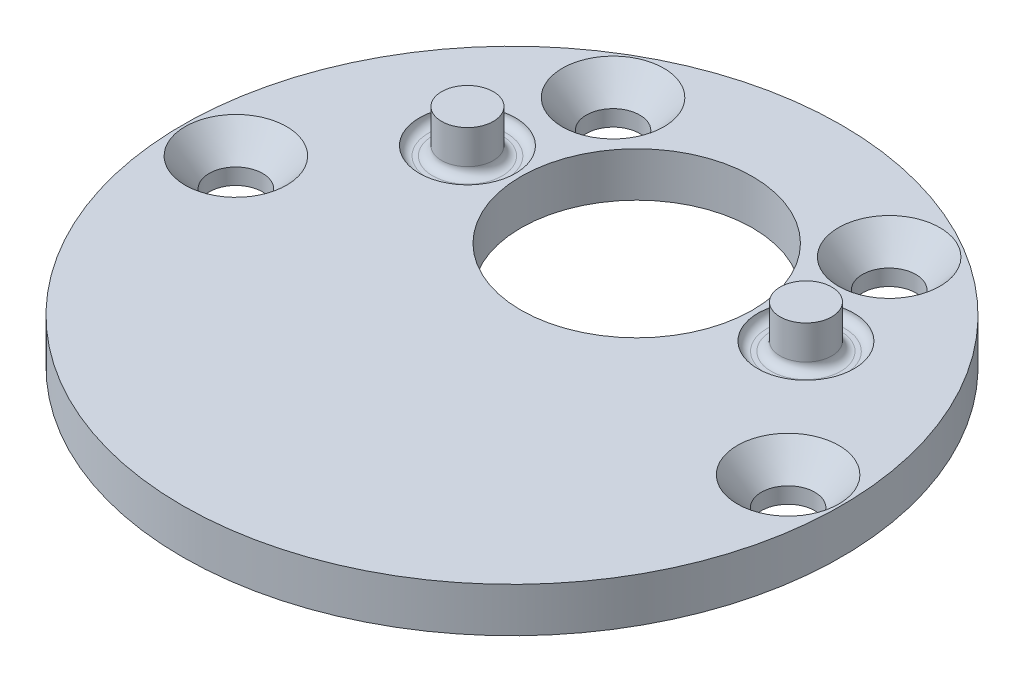
from build123d import *

# Parameters (mm, degrees)
SKETCH1_R                = 18.5
SKETCH1_R_2              = 1.5
BOSS_EXTRUDE1_DEPTH      = 2.5
BOSS_EXTRUDE2_DEPTH      = 1.9
BOSS_EXTRUDE2_DEPTH_BACK = 1
SKETCH2_R                = 1.45
CUT_EXTRUDE3_START       = -0.5
SKETCH6_R                = 2.7
SKETCH6_R_2              = 1.45
CUT_EXTRUDE3_DEPTH       = 0.5
SKETCH4_R                = 6.5
CUT_EXTRUDE1_DEPTH       = 27.282123202
CHAMFER1_SIZE            = 1.35
CHAMFER1_SIZE2           = 1.6
FILLET1_R                = 0.5


with BuildPart() as part:
    # Sketch1 → Boss-Extrude1 (new body)
    with BuildSketch(Plane(origin=(0, 0, 0), x_dir=(1, 0, 0), z_dir=(0, 1, 0))):
        with Locations(Location((0, 0, 0), (0, 0, 270))):
            Circle(SKETCH1_R)
        with Locations(Location((-7.75, 13.423393759, 0), (0, 0, 270))):
            Circle(SKETCH1_R_2, mode=Mode.SUBTRACT)
        with Locations(Location((-15.5, 0, 0), (0, 0, 270))):
            Circle(SKETCH1_R_2, mode=Mode.SUBTRACT)
        with Locations(Location((7.75, 13.423393759, 0), (0, 0, 270))):
            Circle(SKETCH1_R_2, mode=Mode.SUBTRACT)
        with Locations(Location((15.5, 0, 0), (0, 0, 270))):
            Circle(SKETCH1_R_2, mode=Mode.SUBTRACT)
    extrude(amount=BOSS_EXTRUDE1_DEPTH)

    # Sketch2 → Boss-Extrude2 (add, two sides: drawn at the far end of the back side and taken through both)
    with BuildSketch(Plane(origin=(0, 2.5, 0), x_dir=(1, 0, 0), z_dir=(0, 1, 0)).offset(-BOSS_EXTRUDE2_DEPTH_BACK)):
        with Locations(Location((-9.5, 7, 0), (0, 0, 270))):
            Circle(SKETCH2_R)
        with Locations(Location((9.5, 7, 0), (0, 0, 270))):
            Circle(SKETCH2_R)
    extrude(amount=BOSS_EXTRUDE2_DEPTH + BOSS_EXTRUDE2_DEPTH_BACK)

    # Sketch6 → Cut-Extrude3 (cut)
    # profile 1 of 2: a face of its own
    with BuildSketch(Plane(origin=(0, 2.5, 0), x_dir=(1, 0, 0), z_dir=(0, 1, 0)).offset(CUT_EXTRUDE3_START)):
        with Locations(Location((-9.5, 7, 0), (0, 0, 270))):
            Circle(SKETCH6_R)
        with Locations(Location((-9.5, 7, 0), (0, 0, 270))):
            Circle(SKETCH6_R_2, mode=Mode.SUBTRACT)
    # profile 2 of 2: a face of its own
    with BuildSketch(Plane(origin=(0, 2.5, 0), x_dir=(1, 0, 0), z_dir=(0, 1, 0)).offset(CUT_EXTRUDE3_START)):
        with Locations(Location((9.5, 7, 0), (0, 0, 270))):
            Circle(SKETCH6_R)
        with Locations(Location((9.5, 7, 0), (0, 0, 270))):
            Circle(SKETCH6_R_2, mode=Mode.SUBTRACT)
    extrude(amount=CUT_EXTRUDE3_DEPTH, mode=Mode.SUBTRACT)

    # Sketch4 → Cut-Extrude1 (cut, through all)
    with BuildSketch(Plane(origin=(0, 2.5, 0), x_dir=(1, 0, 0), z_dir=(0, 1, 0))):
        with Locations(Location((0, 7, 0), (0, 0, 270))):
            Circle(SKETCH4_R)
    extrude(amount=-CUT_EXTRUDE1_DEPTH, mode=Mode.SUBTRACT)

    # Chamfer1
    chamfer1_edges = [part.edges().sort_by_distance(p)[0] for p in [
        (7.75, 2.5, -14.923393759),
        (15.5, 2.5, -1.5),
        (-7.75, 2.5, -14.923393759),
        (-15.5, 2.5, -1.5),
    ]]
    chamfer1_side = [part.faces().sort_by_distance(p)[0] for p in [
        (0, 2.5, 1.657677708),
    ]]
    chamfer(chamfer1_edges, length=CHAMFER1_SIZE, length2=CHAMFER1_SIZE2, reference=chamfer1_side[0])

    # Fillet1
    fillet1_edges = [part.edges().sort_by_distance(p)[0] for p in [
        (-9.5, 2, -9.7),
        (-9.5, 2, -8.45),
        (9.5, 2, -9.7),
        (9.5, 2, -8.45),
    ]]
    fillet(fillet1_edges, radius=FILLET1_R - 0.0001)  # a hair under: the kernel refuses the full size


solid = part.part
